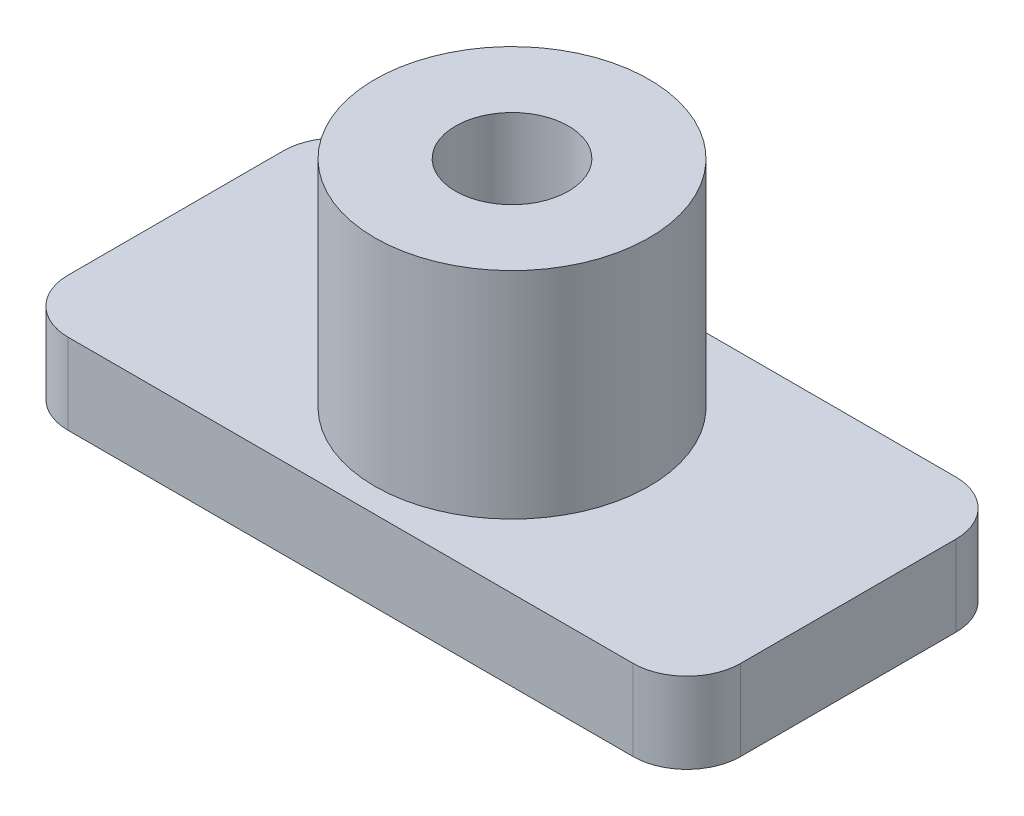
from build123d import *

# Parameters (mm, degrees)
SKETCH1_W           = 25
SKETCH1_H           = 12
BOSS_EXTRUDE1_DEPTH = 3
SKETCH2_R           = 5.1
SKETCH2_R_2         = 2.1
BOSS_EXTRUDE2_DEPTH = 8
FILLET1_R           = 2


with BuildPart() as part:
    # Sketch1 → Boss-Extrude1 (new body)
    with BuildSketch(Plane(origin=(0, 0, 0), x_dir=(1, 0, 0), z_dir=(0, 1, 0))):
        Rectangle(SKETCH1_W, SKETCH1_H)
    extrude(amount=BOSS_EXTRUDE1_DEPTH)

    # Sketch2 → Boss-Extrude2 (add)
    with BuildSketch(Plane(origin=(0, 3, 0), x_dir=(1, 0, 0), z_dir=(0, 1, 0))):
        Circle(SKETCH2_R)
        Circle(SKETCH2_R_2, mode=Mode.SUBTRACT)
    extrude(amount=BOSS_EXTRUDE2_DEPTH)

    # Fillet1
    fillet1_edges = [part.edges().sort_by_distance(p)[0] for p in [
        (12.5, 1.5, -6),
        (12.5, 1.5, 6),
        (-12.5, 1.5, -6),
        (-12.5, 1.5, 6),
    ]]
    fillet(fillet1_edges, radius=FILLET1_R)


solid = part.part
